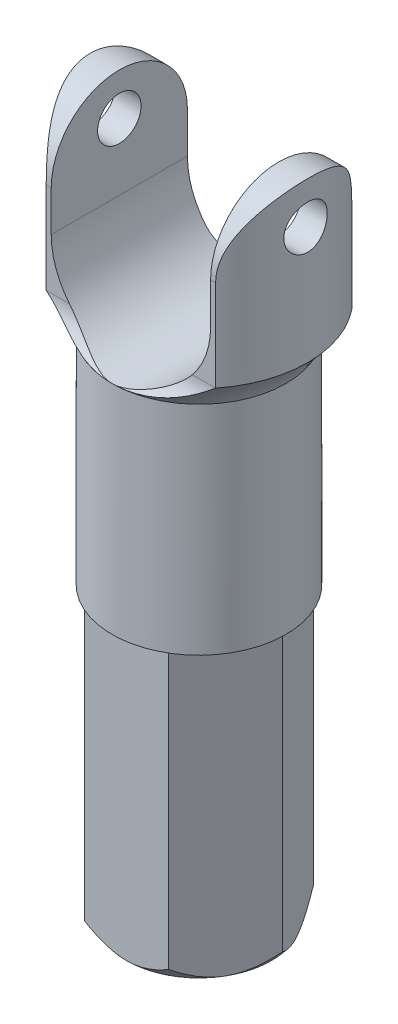
from build123d import *

# Parameters (mm, degrees)
SKETCH1_R                                         = 3
BOSS_EXTRUDE1_DEPTH                               = 16.5
SKETCH2_R                                         = 3.000000000000001
BOSS_EXTRUDE2_DEPTH                               = 1
SKETCH4_R                                         = 3.75
BOSS_EXTRUDE3_DEPTH                               = 5.5
CUT_EXTRUDE2_DEPTH                                = 25.578954540419335
CUT_EXTRUDE2_DEPTH_BACK                           = 25.578954540419335
CUT_EXTRUDE3_DEPTH                                = 25.47575343375821
CUT_EXTRUDE3_DEPTH_BACK                           = 25.47575343375821
CUT_EXTRUDE4_DEPTH                                = 25.47575343375821
CUT_EXTRUDE4_DEPTH_BACK                           = 25.47575343375821
SKETCH7_R                                         = 0.7500000000000012
SKETCH9_OUTSIDE_W                                 = 14.670000000000002
SKETCH9_OUTSIDE_H                                 = 13.170000000000002
CUT_EXTRUDE5_DEPTH                                = 10
SKETCH10_OUTSIDE_W                                = 57.42400000000001
SKETCH10_OUTSIDE_H                                = 55.92400000000001
SKETCH10_OUTSIDE_R                                = 2.5
CUT_EXTRUDE6_DEPTH                                = 25.475753435044876
CUT_EXTRUDE6_DRAFT                                = -40.000000000000085
CSK_FOR_M2_5_FLAT_HEAD_MACHINE_SCREW1_D           = 2
CSK_FOR_M2_5_FLAT_HEAD_MACHINE_SCREW1_DEPTH       = 6
CSK_FOR_M2_5_FLAT_HEAD_MACHINE_SCREW1_CSINK_D     = 2.5
CSK_FOR_M2_5_FLAT_HEAD_MACHINE_SCREW1_CSINK_ANGLE = 90
CSK_FOR_M2_5_FLAT_HEAD_MACHINE_SCREW1_TIP         = 0.6008606190275603


with BuildPart() as part:
    # Sketch1 → Boss-Extrude1 (new body)
    with BuildSketch(Plane(origin=(0, 0, 0), x_dir=(1, 0, 0), z_dir=(0, 1, 0))):
        with Locations(Location((0, 0, 0), (0, 0, 270))):
            Circle(SKETCH1_R)
    extrude(amount=BOSS_EXTRUDE1_DEPTH)

    # Sketch2 → Boss-Extrude2 (add)
    with BuildSketch(Plane(origin=(0, 16.5, 0), x_dir=(1, 0, 0), z_dir=(0, 1, 0))):
        with Locations(Location((0, 0, 0), (0, 0, 270))):
            Circle(SKETCH2_R)
    extrude(amount=BOSS_EXTRUDE2_DEPTH)

    # Loft1: read off the stored shape, not the designer's step
    # Loft1: loft between two sections, ruled curve by curve
    loft1_from = [
        Edge.make_bspline([(-2.972668255, 17.5, -0.404033968), (-3.780736192, 17.5, 5.541302541), (2.164600318, 17.5, 6.349370478), (2.972668255, 17.5, 0.404033968), (3.780736192, 17.5, -5.541302541), (-2.164600318, 17.5, -6.349370478), (-2.972668255, 17.5, -0.404033968)], [0, 0, 0, 0, 0.5, 0.5, 0.5, 1, 1, 1, 1], 3, [1, 0.333333333333333, 0.333333333333333, 1, 0.333333333333333, 0.333333333333333, 1]),
    ]
    loft1_to = [
        Edge.make_bspline([(-3.66375351, 18.5, 0.799631301), (-2.064490908, 18.5, 8.127138321), (5.263016112, 18.5, 6.527875719), (3.66375351, 18.5, -0.799631301), (2.064490908, 18.5, -8.127138321), (-5.263016112, 18.5, -6.527875719), (-3.66375351, 18.5, 0.799631301)], [0, 0, 0, 0, 0.5, 0.5, 0.5, 1, 1, 1, 1], 3, [1, 0.333333333333333, 0.333333333333333, 1, 0.333333333333333, 0.333333333333333, 1]),
    ]
    loft1 = Solid(Shell([*[Face.make_surface_from_curves(loft1_from[k], loft1_to[k]) for k in range(1)], Face(Wire(loft1_from)), Face(Wire(loft1_to))]))
    add(loft1)

    # Sketch4 → Boss-Extrude3 (add)
    with BuildSketch(Plane(origin=(0, 18.500000000000004, 0), x_dir=(1, 0, 0), z_dir=(0, 1, 0))):
        with Locations(Location((0, 0, 0), (0, 0, 192.312))):
            Circle(SKETCH4_R)
    extrude(amount=BOSS_EXTRUDE3_DEPTH)

    # Sketch5 → Cut-Extrude2 (cut, two sides: drawn at the far end of the back side and taken through both)
    with BuildSketch(Plane(origin=(0, 0, 0), x_dir=(0, 0, -1), z_dir=(1, 0, 0)).offset(-CUT_EXTRUDE2_DEPTH_BACK)):
        with BuildLine():
            Line((2.3499999999999996, 21.650000000000002), (2.3499999999999996, 18.500000000000004))
            ThreePointArc((2.3500000000000005, 18.500000000000004), (2.526779966000519, 17.903656977914096), (2.9999999999709317, 17.5))
            Line((2.999999999970932, 17.5), (3.75, 18.500000000000004))
            Line((3.75, 18.500000000000004), (3.75, 24))
            Line((3.75, 24), (1.33e-15, 24))
            ThreePointArc((1.19e-15, 24), (1.6617009357883865, 23.311700935788387), (2.349999999999999, 21.650000000000002))
        make_face()
        with BuildLine():
            ThreePointArc((-2.349999999999999, 21.650000000000002), (-1.661700935788386, 23.311700935788387), (1.19e-15, 24))
            Line((1.33e-15, 24), (-3.75, 24))
            Line((-3.75, 24), (-3.75, 18.500000000000004))
            Line((-3.75, 18.500000000000004), (-2.999999999970932, 17.5))
            ThreePointArc((-2.999999999970932, 17.5), (-2.526779966000519, 17.903656977914096), (-2.3499999999999996, 18.500000000000004))
            Line((-2.3499999999999996, 18.500000000000004), (-2.3499999999999996, 21.650000000000002))
        make_face()
    extrude(amount=CUT_EXTRUDE2_DEPTH + CUT_EXTRUDE2_DEPTH_BACK, mode=Mode.SUBTRACT)

    # Sketch6 → Cut-Extrude3 (cut, two sides: drawn at the far end of the back side and taken through both)
    with BuildSketch(Plane.XY.offset(-CUT_EXTRUDE3_DEPTH_BACK)):
        with BuildLine():
            Line((2.75, 20.249999999999996), (2.75, 23.999999999999996))
            Line((2.75, 23.999999999999996), (-2.75, 23.999999999999996))
            Line((-2.75, 23.999999999999996), (-2.75, 20.249999999999996))
            ThreePointArc((-2.75, 20.249999999999996), (1.7e-16, 17.5), (2.75, 20.249999999999996))
        make_face()
    extrude(amount=CUT_EXTRUDE3_DEPTH + CUT_EXTRUDE3_DEPTH_BACK, mode=Mode.SUBTRACT)

    # Sketch7 → Cut-Extrude4 (cut, two sides: drawn at the far end of the back side and taken through both)
    with BuildSketch(Plane(origin=(0, 0, 0), x_dir=(0, 0, -1), z_dir=(1, 0, 0)).offset(-CUT_EXTRUDE4_DEPTH_BACK)):
        with Locations((0, 22.55)):
            Circle(SKETCH7_R)
    extrude(amount=CUT_EXTRUDE4_DEPTH + CUT_EXTRUDE4_DEPTH_BACK, mode=Mode.SUBTRACT)

    # Sketch9 outside → Cut-Extrude5 (cut)
    with BuildSketch(Plane.XZ):
        Rectangle(SKETCH9_OUTSIDE_W, SKETCH9_OUTSIDE_H)
        Polygon((2.8867513459481295, -4.3e-16), (1.4433756729740628, 2.5000000000000004), (-1.4433756729740648, 2.5000000000000004), (-2.88675134594813, 0), (-1.4433756729740648, -2.499999999999999), (1.4433756729740657, -2.499999999999999), align=None, mode=Mode.SUBTRACT)
    extrude(amount=-CUT_EXTRUDE5_DEPTH, mode=Mode.SUBTRACT)


with BuildPart() as cut_extrude6_tool:
    # Sketch10 outside → Cut-Extrude6 (with draft: the straight prism first)
    with BuildSketch(Plane.XZ):
        Rectangle(SKETCH10_OUTSIDE_W, SKETCH10_OUTSIDE_H)
        Circle(SKETCH10_OUTSIDE_R, mode=Mode.SUBTRACT)
    extrude(amount=-CUT_EXTRUDE6_DEPTH)
    # Cut-Extrude6: the draft: its side faces are tilted about the plane it starts from
    cut_extrude6_sides = [cut_extrude6_tool.faces().sort_by_distance(p)[0] for p in [
        (0, 12.737876718, -27.962),
        (28.712, 12.737876718, 0),
        (0, 12.737876718, 27.962),
        (-28.712, 12.737876718, 0),
        (-2.5, 12.737876718, 0),
    ]]
    draft(cut_extrude6_sides, Plane.XZ, CUT_EXTRUDE6_DRAFT)


with BuildPart() as part_1:
    add(part.part)

    # Cut-Extrude6: cut by cut_extrude6_tool
    add(cut_extrude6_tool.part, mode=Mode.SUBTRACT)

    # CSK for M2.5 Flat Head Machine Screw1
    with Locations(Plane(origin=(0, 0, 0), x_dir=(-1, 0, 0), z_dir=(0, -1, 0))):
        with Locations((0, 0)):
            CounterSinkHole(CSK_FOR_M2_5_FLAT_HEAD_MACHINE_SCREW1_D / 2, CSK_FOR_M2_5_FLAT_HEAD_MACHINE_SCREW1_CSINK_D / 2, depth=CSK_FOR_M2_5_FLAT_HEAD_MACHINE_SCREW1_DEPTH, counter_sink_angle=CSK_FOR_M2_5_FLAT_HEAD_MACHINE_SCREW1_CSINK_ANGLE)
            with Locations((0, 0, -(CSK_FOR_M2_5_FLAT_HEAD_MACHINE_SCREW1_DEPTH + CSK_FOR_M2_5_FLAT_HEAD_MACHINE_SCREW1_TIP / 2))):  # 118° drill point
                Cone(0, CSK_FOR_M2_5_FLAT_HEAD_MACHINE_SCREW1_D / 2, CSK_FOR_M2_5_FLAT_HEAD_MACHINE_SCREW1_TIP, mode=Mode.SUBTRACT)


solid = part_1.part
